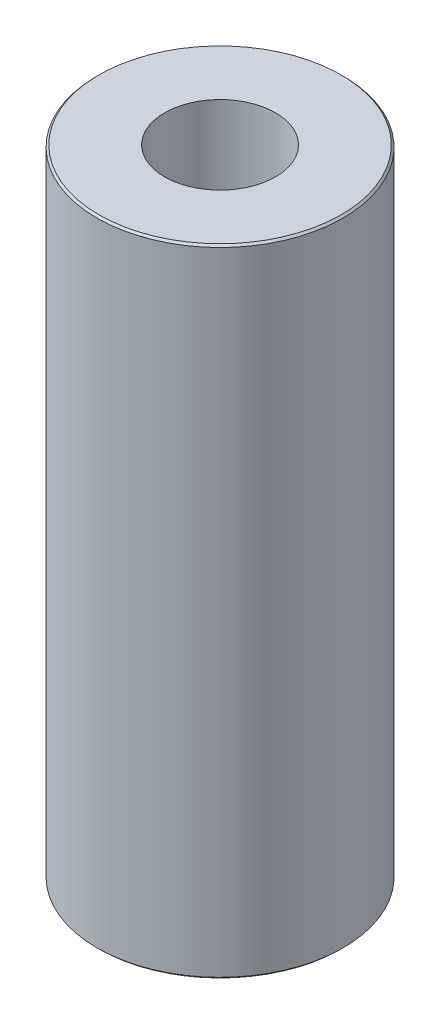
from build123d import *

# Parameters (mm, degrees)
SKETCH1_R           = 35
BOSS_EXTRUDE1_DEPTH = 180.864894283
SKETCH2_R           = 15.789190654
CUT_EXTRUDE1_DEPTH  = 188.515625973
CHAMFER1_SIZE       = 0.547495591


with BuildPart() as part:
    # Sketch1 → Boss-Extrude1 (new body)
    with BuildSketch(Plane(origin=(0, 0, 0), x_dir=(1, 0, 0), z_dir=(0, 1, 0))):
        Circle(SKETCH1_R)
    extrude(amount=BOSS_EXTRUDE1_DEPTH)

    # Sketch2 → Cut-Extrude1 (cut, through all)
    with BuildSketch(Plane(origin=(0, 0, 0), x_dir=(1, 0, 0), z_dir=(0, 1, 0))):
        Circle(SKETCH2_R)
    extrude(amount=CUT_EXTRUDE1_DEPTH, mode=Mode.SUBTRACT)

    # Chamfer1
    chamfer1_edges = [part.edges().sort_by_distance(p)[0] for p in [
        (-35, 180.864894283, 0),
        (-35, 0, 0),
    ]]
    chamfer(chamfer1_edges, length=CHAMFER1_SIZE)


solid = part.part
